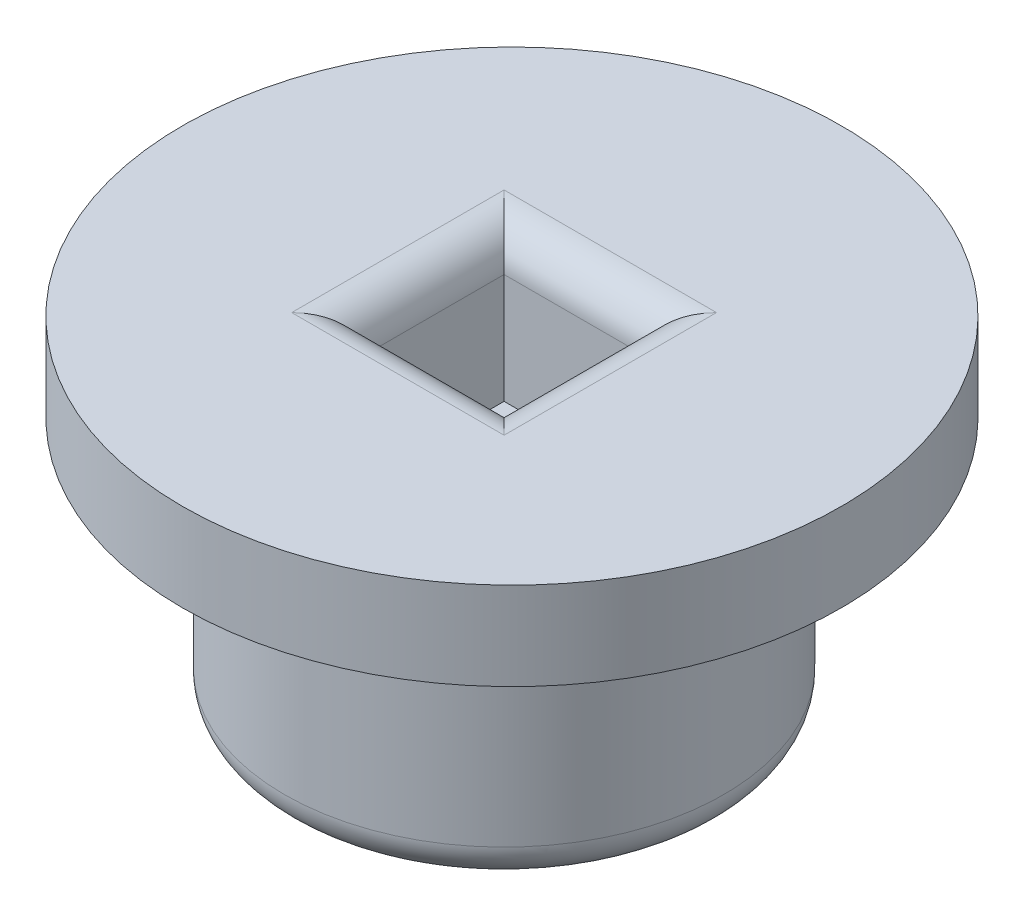
from build123d import *

# Parameters (mm, degrees)
SKETCH_1_R          = 3
EXTRUDE_1_DEPTH     = 3.5
SKETCH_2_R          = 4.5
EXTRUDE_2_DEPTH     = 1.2
SKETCH_4_W          = 1.9
SKETCH_4_H          = 1.9
CUT_EXTRUDE_1_DEPTH = 2
FILLET_1_R          = 0.5
FILLET_2_R          = 0.5


with BuildPart() as part:
    # 草图1 → 凸台-拉伸1 (new body)
    with BuildSketch(Plane(origin=(0, 0, 0), x_dir=(1, 0, 0), z_dir=(0, 1, 0))):
        Circle(SKETCH_1_R)
    extrude(amount=EXTRUDE_1_DEPTH)

    # 草图2 → 凸台-拉伸2 (add)
    with BuildSketch(Plane(origin=(0, 3.5, 0), x_dir=(1, 0, 0), z_dir=(0, 1, 0))):
        with Locations((0.094879954, 0.012027373)):
            Circle(SKETCH_2_R)
    extrude(amount=EXTRUDE_2_DEPTH)

    # 草图4 → 切除-拉伸1 (cut)
    with BuildSketch(Plane(origin=(0, 4.7, 0), x_dir=(1, 0, 0), z_dir=(0, 1, 0))):
        Rectangle(SKETCH_4_W, SKETCH_4_H)
    extrude(amount=-CUT_EXTRUDE_1_DEPTH, mode=Mode.SUBTRACT)

    # 圆角1
    fillet_1_edges = [part.edges().sort_by_distance(p)[0] for p in [
        (-3, 0, 0),
    ]]
    fillet(fillet_1_edges, radius=FILLET_1_R)

    # 圆角2
    fillet_2_edges = [part.edges().sort_by_distance(p)[0] for p in [
        (0, 4.7, 0.95),
        (-0.95, 4.7, 0),
        (0, 4.7, -0.95),
        (0.95, 4.7, 0),
    ]]
    fillet(fillet_2_edges, radius=FILLET_2_R)


solid = part.part
